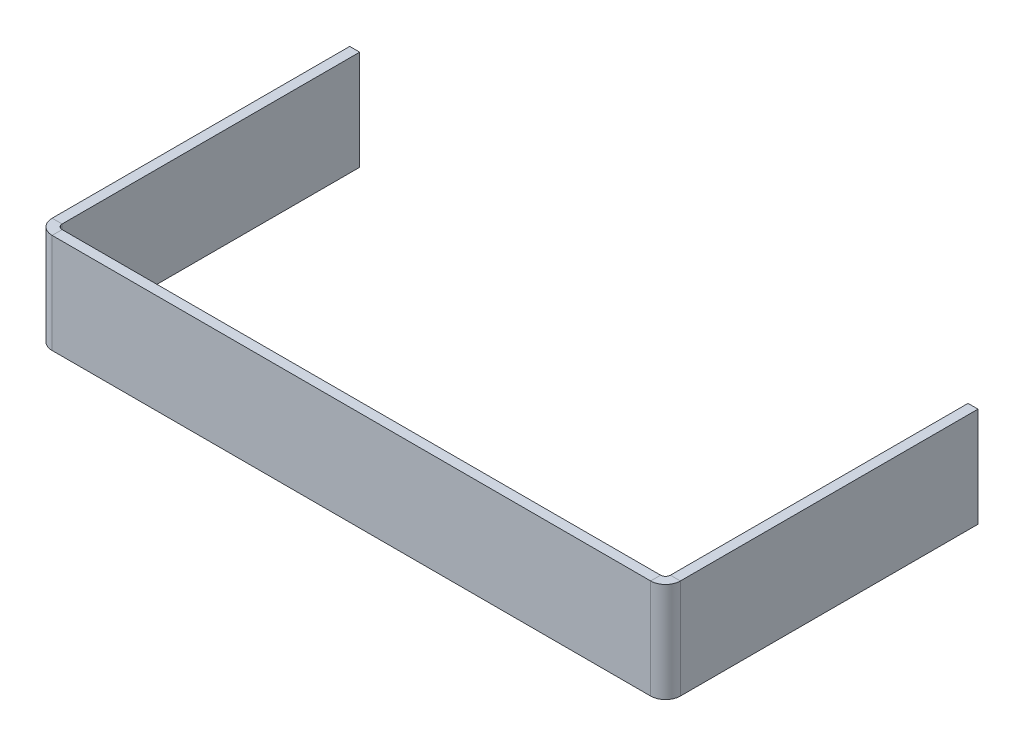
from build123d import *

# Parameters (mm, degrees)
BASE_FLANGE1_DEPTH           = 1.5
EDGE_FLANGE1_STRIP_W         = 7.4732
EDGE_FLANGE1_STRIP_H         = 1.5
EDGE_FLANGE1_STRIP_CUT_DEPTH = 15
EDGE_FLANGE1_DEPTH           = 15
EDGE_FLANGE2_STRIP_W         = 7.4732
EDGE_FLANGE2_STRIP_H         = 1.5
EDGE_FLANGE2_STRIP_CUT_DEPTH = 15
EDGE_FLANGE2_DEPTH           = 15


# Sheet-metal steps are written as plain solids
with BuildPart() as part:
    # Sketch3 → Base-Flange1 (new body)
    with BuildSketch(Plane.ZY.offset(-75)):
        Polygon((0, 15), (41.5, 15), (41.5, 0), (0, 0), (-4, 0), (-4, 15), align=None)
    extrude(amount=-BASE_FLANGE1_DEPTH)

    # Edge-Flange1 strip (across the edge) → Edge-Flange1 strip cut (cut)
    with BuildSketch(Plane(origin=(75, 0, 41.5), x_dir=(0, 0, -1), z_dir=(0, 1, 0))):
        with Locations((-3, -0.75)):
            Rectangle(EDGE_FLANGE1_STRIP_W, EDGE_FLANGE1_STRIP_H)
    extrude(amount=EDGE_FLANGE1_STRIP_CUT_DEPTH, mode=Mode.SUBTRACT)

    # Edge-Flange1 section (across the edge) → Edge-Flange1 (add)
    with BuildSketch(Plane(origin=(75, 0, 41.5), x_dir=(0, 0, -1), z_dir=(0, 1, 0))):
        with BuildLine():
            Line((-1.5, 0.7366), (-1.5, 91.5))
            Line((-1.5, 91.5), (0, 91.5))
            Line((0, 91.5), (0, 0.7366))
            ThreePointArc((0, 0.7366), (0.215745145, 0.215745145), (0.7366, 0))
            Line((0.7366, 0), (0.7366, -1.5))
            ThreePointArc((0.7366, -1.5), (-0.844915027, -0.844915027), (-1.5, 0.7366))
        make_face()
    extrude(amount=EDGE_FLANGE1_DEPTH)

    # Edge-Flange2 strip (across the edge) → Edge-Flange2 strip cut (cut)
    with BuildSketch(Plane(origin=(-16.5, 0, 41.5), x_dir=(1, 0, 0), z_dir=(0, 1, 0))):
        with Locations((-3, -0.75)):
            Rectangle(EDGE_FLANGE2_STRIP_W, EDGE_FLANGE2_STRIP_H)
    extrude(amount=EDGE_FLANGE2_STRIP_CUT_DEPTH, mode=Mode.SUBTRACT)

    # Edge-Flange2 section (across the edge) → Edge-Flange2 (add)
    with BuildSketch(Plane(origin=(-16.5, 0, 41.5), x_dir=(1, 0, 0), z_dir=(0, 1, 0))):
        with BuildLine():
            Line((-1.5, 0.7366), (-1.5, 45.5))
            Line((-1.5, 45.5), (0, 45.5))
            Line((0, 45.5), (0, 0.7366))
            ThreePointArc((0, 0.7366), (0.215745145, 0.215745145), (0.7366, 0))
            Line((0.7366, 0), (0.7366, -1.5))
            ThreePointArc((0.7366, -1.5), (-0.844915027, -0.844915027), (-1.5, 0.7366))
        make_face()
    extrude(amount=EDGE_FLANGE2_DEPTH)


solid = part.part
